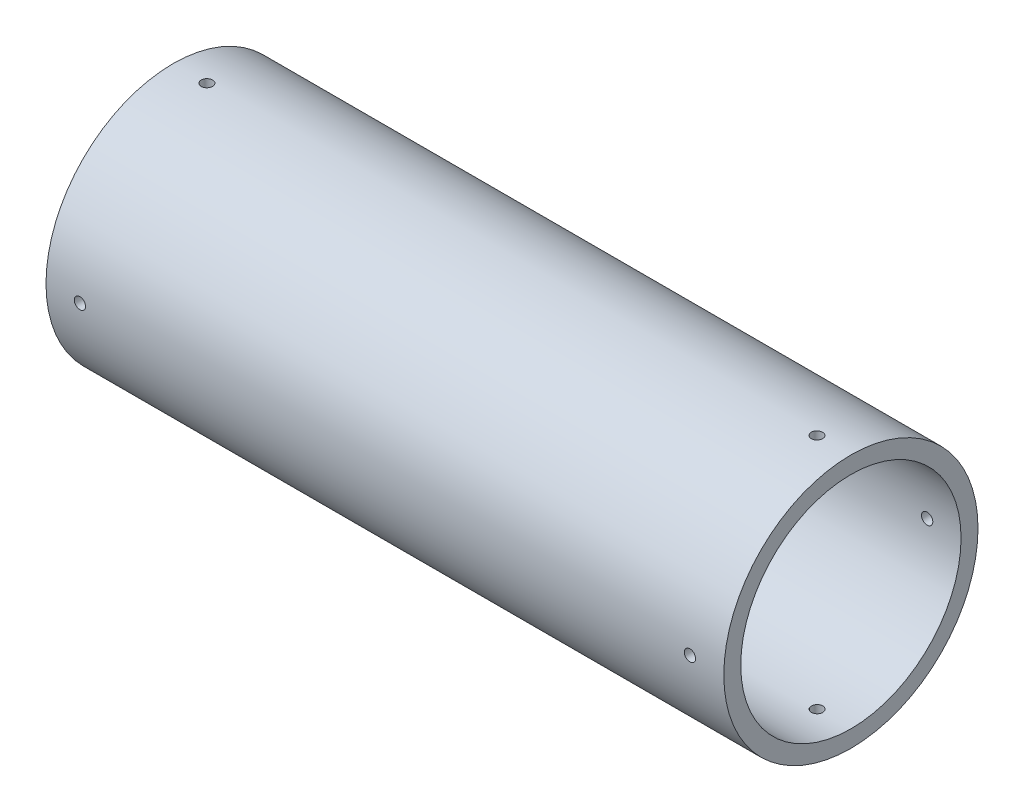
from build123d import *

# Parameters (mm, degrees)
SKETCH_1_R               = 22.5
SKETCH_1_R_2             = 19.5
EXTRUDE_1_DEPTH          = 120
SKETCH_3_R               = 1
CUT_EXTRUDE_1_DEPTH      = 10
PATTERN_CIRCULAR_1_COUNT = 4


with BuildPart() as part:
    # Эскиз1 → Бобышка-Вытянуть1 (new body)
    with BuildSketch(Plane(origin=(0, 0, 0), x_dir=(0, 0, -1), z_dir=(1, 0, 0))):
        Circle(SKETCH_1_R)
        Circle(SKETCH_1_R_2, mode=Mode.SUBTRACT)
    extrude(amount=EXTRUDE_1_DEPTH)

    # Эскиз3 → Вырез-Вытянуть1 (cut)
    with BuildSketch(Plane(origin=(0, 22.5, 0), x_dir=(1, 0, 0), z_dir=(0, 1, 0))):
        with Locations((6, 0)):
            Circle(SKETCH_3_R)
        with Locations((114, 0)):
            Circle(SKETCH_3_R)
    cut_extrude_1 = extrude(amount=-CUT_EXTRUDE_1_DEPTH, mode=Mode.SUBTRACT)

    # Круговой массив1: Вырез-Вытянуть1 ×4 about axis
    pattern_circular_1_axis = Axis((120, 0, 0), (-1, 0, 0))
    for i in range(1, PATTERN_CIRCULAR_1_COUNT):
        add(cut_extrude_1.rotate(pattern_circular_1_axis, i * 360 / PATTERN_CIRCULAR_1_COUNT), mode=Mode.SUBTRACT)


solid = part.part
